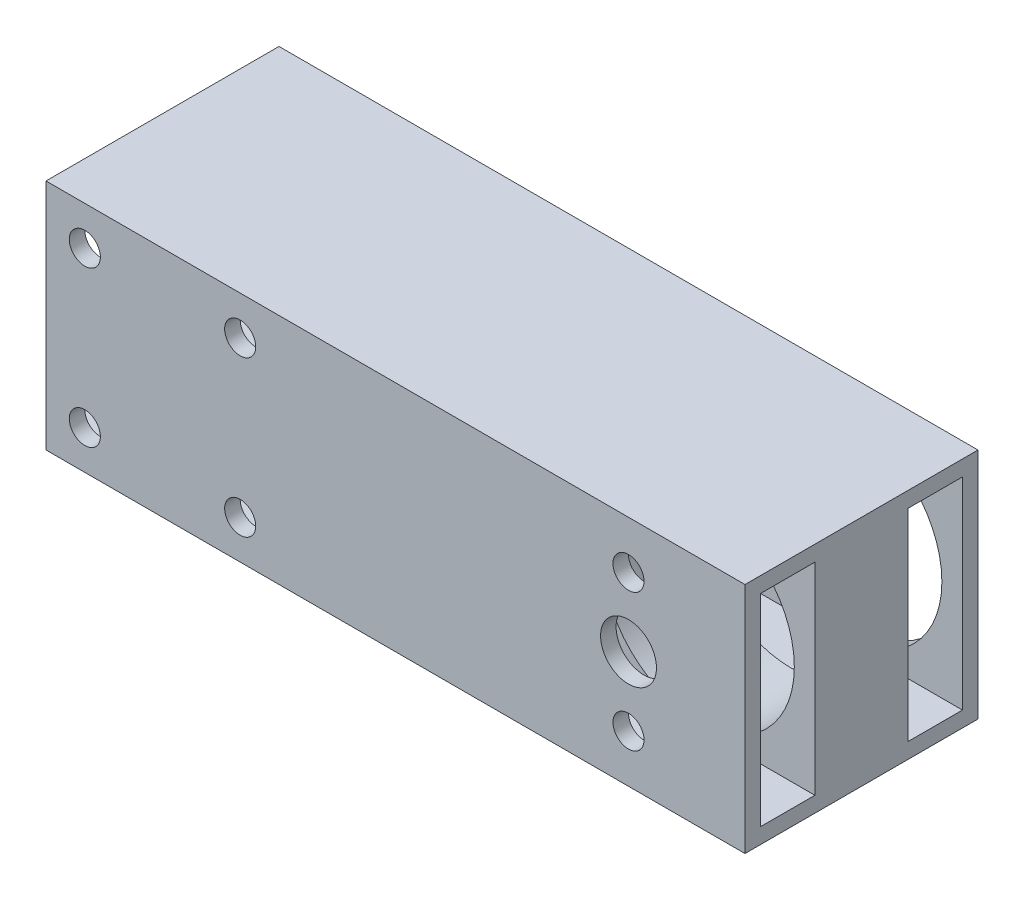
from build123d import *

# Parameters (mm, degrees)
SKETCH1_W           = 30
SKETCH1_H           = 30
SKETCH1_W_2         = 7
SKETCH1_H_2         = 26
BOSS_EXTRUDE3_DEPTH = 90
SKETCH6_R           = 12.35
CUT_EXTRUDE5_DEPTH  = 23
SKETCH8_R           = 3.6
SKETCH8_R_2         = 2
CUT_EXTRUDE6_DEPTH  = 17
SKETCH9_W           = 12
SKETCH9_H           = 26
CUT_EXTRUDE7_DEPTH  = 59
SKETCH10_R          = 2
CUT_EXTRUDE8_DEPTH  = 34


with BuildPart() as part:
    # Sketch1 → Boss-Extrude3 (new body)
    with BuildSketch(Plane(origin=(0, 0, 0), x_dir=(0, 0, -1), z_dir=(1, 0, 0))):
        Rectangle(SKETCH1_W, SKETCH1_H)
        with Locations((-9.5, 0)):
            Rectangle(SKETCH1_W_2, SKETCH1_H_2, mode=Mode.SUBTRACT)
        with Locations((9.5, 0)):
            Rectangle(SKETCH1_W_2, SKETCH1_H_2, mode=Mode.SUBTRACT)
    extrude(amount=BOSS_EXTRUDE3_DEPTH)

    # Sketch6 → Cut-Extrude5 (cut)
    with BuildSketch(Plane(origin=(0, 0, -15), x_dir=(-1, 0, 0), z_dir=(0, 0, -1))):
        with Locations((-75, 0)):
            Circle(SKETCH6_R)
    extrude(amount=-CUT_EXTRUDE5_DEPTH, mode=Mode.SUBTRACT)

    # Sketch8 → Cut-Extrude6 (cut)
    with BuildSketch(Plane.XY.offset(15)):
        with Locations((75, 0)):
            Circle(SKETCH8_R)
        with Locations((75, 8.85)):
            Circle(SKETCH8_R_2)
        with Locations((75, -8.85)):
            Circle(SKETCH8_R_2)
    extrude(amount=-CUT_EXTRUDE6_DEPTH, mode=Mode.SUBTRACT)

    # Sketch9 → Cut-Extrude7 (cut)
    with BuildSketch(Plane.ZY):
        Rectangle(SKETCH9_W, SKETCH9_H)
    extrude(amount=-CUT_EXTRUDE7_DEPTH, mode=Mode.SUBTRACT)

    # Sketch10 → Cut-Extrude8 (cut)
    with BuildSketch(Plane(origin=(0, 0, -15), x_dir=(-1, 0, 0), z_dir=(0, 0, -1))):
        with Locations((-25.002859351, 10)):
            Circle(SKETCH10_R)
        with Locations((-5, 10)):
            Circle(SKETCH10_R)
        with Locations((-25.002859351, -10)):
            Circle(SKETCH10_R)
        with Locations((-5, -10)):
            Circle(SKETCH10_R)
    extrude(amount=-CUT_EXTRUDE8_DEPTH, mode=Mode.SUBTRACT)


solid = part.part
